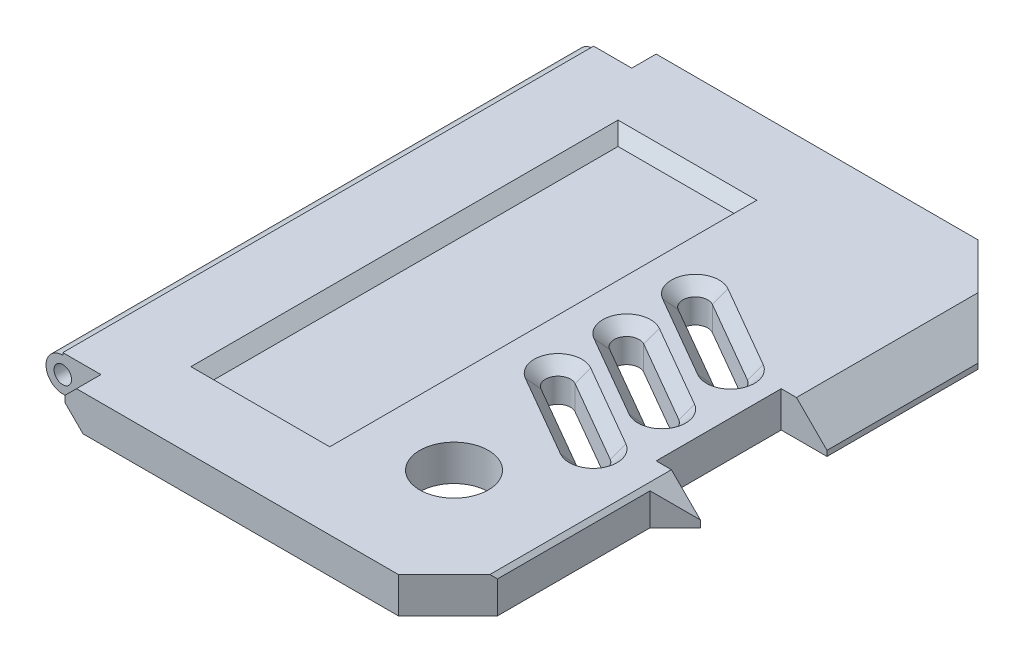
from build123d import *

# Parameters (mm, degrees)
BOSS_EXTRUDE1_START         = 10
SKETCH1_R                   = 1.15
BOSS_EXTRUDE1_DEPTH         = 76
SKETCH2_W                   = 6
SKETCH2_H                   = 16.4
CUT_EXTRUDE1_DEPTH          = 76
BOSS_EXTRUDE2_START         = -22
BOSS_EXTRUDE2_DEPTH         = 22
BOSS_EXTRUDE2_2_DEPTH       = 2
BOSS_EXTRUDE2_3_OUTLINE_W   = 6
BOSS_EXTRUDE2_3_OUTLINE_H   = 16
BOSS_EXTRUDE2_3_OUTLINE_W_2 = 5
BOSS_EXTRUDE2_3_OUTLINE_H_2 = 3
BOSS_EXTRUDE2_3_DEPTH       = 5
BOSS_EXTRUDE2_START_2       = -51.8
BOSS_EXTRUDE2_4_DEPTH       = 67
BOSS_EXTRUDE2_START_3       = -59
BOSS_EXTRUDE2_5_OUTLINE_R   = 1.15
BOSS_EXTRUDE2_5_DEPTH       = 78
CHAMFER1_SIZE               = 10
CHAMFER2_SIZE               = 4
CHAMFER3_SIZE               = 4
SKETCH4_W                   = 6
SKETCH4_H                   = 3.2
CUT_EXTRUDE2_DEPTH          = 17
CUT_EXTRUDE4_DEPTH          = 30
CUT_EXTRUDE4_DEPTH_BACK     = 41
SKETCH5_W                   = 96.095535807
SKETCH5_H                   = 97.903785136
SKETCH6_W                   = 65.908561939
SKETCH6_H                   = 2.295323053
CUT_EXTRUDE5_DEPTH          = 108
CUT_EXTRUDE6_DEPTH          = 108
SKETCH9_W                   = 18.2
SKETCH9_H                   = 56
CUT_EXTRUDE8_DEPTH          = 1.5
CUT_EXTRUDE9_DEPTH          = 13.5
CHAMFER4_SIZE               = 1.5
CHAMFER5_SIZE               = 1.5
CUT_EXTRUDE10_DEPTH         = 3.2
CUT_EXTRUDE11_DEPTH         = 3.2
CHAMFER6_SIZE               = 1.5
CUT_EXTRUDE12_DEPTH         = 26
SKETCH15_R                  = 4.5
CUT_EXTRUDE13_DEPTH         = 12


with BuildPart() as part:
    # Sketch1 → Boss-Extrude1 (new body)
    with BuildSketch(Plane(origin=(0, 0, -57.8), x_dir=(-1, 0, 0), z_dir=(0, 0, -1)).offset(BOSS_EXTRUDE1_START)):
        with BuildLine():
            Line((39, 25), (-18.2, 25))
            Line((-18.2, 25), (-18.2, 20))
            Line((-18.2, 20), (39, 20))
            ThreePointArc((39, 20), (41.5, 22.5), (39, 25))
        make_face()
        with Locations((39, 22.5)):
            Circle(SKETCH1_R, mode=Mode.SUBTRACT)
    extrude(amount=BOSS_EXTRUDE1_DEPTH)

    # Sketch2 → Cut-Extrude1 (cut)
    with BuildSketch(Plane(origin=(0, 25, 0), x_dir=(1, 0, 0), z_dir=(0, 1, 0))):
        with Locations((15.2, 105.8)):
            Rectangle(SKETCH2_W, SKETCH2_H)
    extrude(amount=-CUT_EXTRUDE1_DEPTH, mode=Mode.SUBTRACT)

    # Chamfer1
    chamfer1_edges = [part.edges().sort_by_distance(p)[0] for p in [
        (18.2, 22.5, -143.8),
        (18.2, 22.5, -67.8),
    ]]
    chamfer(chamfer1_edges, length=CHAMFER1_SIZE)

    # Chamfer2
    chamfer2_edges = [part.edges().sort_by_distance(p)[0] for p in [
        (18.2, 25, -87.7),
        (18.2, 25, -123.9),
    ]]
    chamfer(chamfer2_edges, length=CHAMFER2_SIZE)

    # Sketch4 → Cut-Extrude2 (cut)
    with BuildSketch(Plane(origin=(0, 25, 0), x_dir=(1, 0, 0), z_dir=(0, 1, 0))):
        with Locations((-38.5, 69.4)):
            Rectangle(SKETCH4_W, SKETCH4_H)
        with Locations((-38.5, 142.2)):
            Rectangle(SKETCH4_W, SKETCH4_H)
    extrude(amount=-CUT_EXTRUDE2_DEPTH, mode=Mode.SUBTRACT)

    # Sketch6 → Cut-Extrude5 (cut)
    with BuildSketch(Plane(origin=(0, 0, -143.8), x_dir=(-1, 0, 0), z_dir=(0, 0, -1))):
        with Locations((13.043955502, 19.152338474)):
            Rectangle(SKETCH6_W, SKETCH6_H)
    extrude(amount=-CUT_EXTRUDE5_DEPTH, mode=Mode.SUBTRACT)

    # Sketch7 → Cut-Extrude6 (cut)
    with BuildSketch(Plane(origin=(0, 0, -140.6), x_dir=(-1, 0, 0), z_dir=(0, 0, -1))):
        with BuildLine():
            Line((39, 24.7), (39, 27.795668708))
            Line((39, 27.795668708), (44.096773439, 22.698895269))
            Line((44.096773439, 22.698895269), (43.273657472, 20.3))
            Line((43.273657472, 20.3), (39, 20.3))
            ThreePointArc((39, 20.3), (41.2, 22.5), (39, 24.7))
        make_face()
    extrude(amount=-CUT_EXTRUDE6_DEPTH, mode=Mode.SUBTRACT)

    # Sketch9 → Cut-Extrude8 (cut)
    with BuildSketch(Plane(origin=(0, 25, 0), x_dir=(1, 0, 0), z_dir=(0, 1, 0))):
        with Locations((-19.9, 105.8)):
            Rectangle(SKETCH9_W, SKETCH9_H)
    extrude(amount=-CUT_EXTRUDE8_DEPTH, mode=Mode.SUBTRACT)

    # Sketch11 → Cut-Extrude9 (cut)
    with BuildSketch(Plane(origin=(0, 25, 0), x_dir=(1, 0, 0), z_dir=(0, 1, 0))):
        with BuildLine():
            Line((-3.382273892, 102.55565443), (7.524013646, 96.258906385))
            ThreePointArc((7.524013646, 96.258906385), (8.123454363, 94.021763172), (5.886311151, 93.422322455))
            Line((5.886311151, 93.422322455), (-5.019976387, 99.719070501))
            ThreePointArc((-5.019976387, 99.719070501), (-5.619417104, 101.956213713), (-3.382273892, 102.55565443))
        make_face()
        with BuildLine():
            Line((-3.382273892, 111.55565443), (7.524013646, 105.258906385))
            ThreePointArc((7.524013646, 105.258906385), (8.123454363, 103.021763172), (5.886311151, 102.422322455))
            Line((5.886311151, 102.422322455), (-5.019976387, 108.719070501))
            ThreePointArc((-5.019976387, 108.719070501), (-5.619417104, 110.956213713), (-3.382273892, 111.55565443))
        make_face()
        with BuildLine():
            Line((-3.382273892, 120.55565443), (7.524013646, 114.258906385))
            ThreePointArc((7.524013646, 114.258906385), (8.123454363, 112.021763172), (5.886311151, 111.422322455))
            Line((5.886311151, 111.422322455), (-5.019976387, 117.719070501))
            ThreePointArc((-5.019976387, 117.719070501), (-5.619417104, 119.956213713), (-3.382273892, 120.55565443))
        make_face()
    extrude(amount=-CUT_EXTRUDE9_DEPTH, mode=Mode.SUBTRACT)

    # Chamfer4
    chamfer4_edges = [part.edges().sort_by_distance(p)[0] for p in [
        (-19.9, 23.5, -133.8),
        (-10.8, 23.5, -105.8),
        (-19.9, 23.5, -77.8),
        (-29, 23.5, -105.8),
    ]]
    chamfer(chamfer4_edges, length=CHAMFER4_SIZE - 0.0001)  # a hair under: the kernel refuses the full size

    # Chamfer5
    chamfer5_edges = [part.edges().sort_by_distance(p)[0] for p in [
        (-5.619417104, 25, -110.956213713),
        (0.433167382, 25, -105.570696478),
        (8.123454363, 25, -103.021763172),
        (2.070869877, 25, -108.407280407),
        (-5.619417104, 25, -119.956213713),
        (0.433167382, 25, -114.570696478),
        (8.123454363, 25, -112.021763172),
        (2.070869877, 25, -117.407280407),
        (-5.619417104, 25, -101.956213713),
        (0.433167382, 25, -96.570696478),
        (8.123454363, 25, -94.021763172),
        (2.070869877, 25, -99.407280407),
    ]]
    chamfer(chamfer5_edges, length=CHAMFER5_SIZE)

    # Sketch12 → Cut-Extrude10 (cut)
    with BuildSketch(Plane(origin=(0, 0, -143.8), x_dir=(-1, 0, 0), z_dir=(0, 0, -1))):
        Polygon((35.5, 22.65), (33.15, 20.3), (34.627405096, 18.349875441), (37.777251213, 19.324937721), align=None)
    extrude(amount=-CUT_EXTRUDE10_DEPTH, mode=Mode.SUBTRACT)

    # Sketch13 → Cut-Extrude11 (cut)
    with BuildSketch(Plane.XY.offset(-67.8)):
        Polygon((-35.5, 22.65), (-33.15, 20.3), (-32.556705416, 17.347754732), (-36.536239956, 18.083750154), align=None)
    extrude(amount=-CUT_EXTRUDE11_DEPTH, mode=Mode.SUBTRACT)

    # Chamfer6
    chamfer6_edges = [part.edges().sort_by_distance(p)[0] for p in [
        (-35.5, 25, -69.4),
        (-35.5, 25, -142.2),
    ]]
    chamfer(chamfer6_edges, length=CHAMFER6_SIZE)

    # Sketch14 → Cut-Extrude12 (cut)
    with BuildSketch(Plane.XZ.offset(-20.3)):
        Polygon((18.2, -97.8), (14.7, -94.3), (14.7, -71.715249411), (21.506629366, -77.723703215), (19.139662716, -97.460563588), align=None)
    extrude(amount=-CUT_EXTRUDE12_DEPTH, mode=Mode.SUBTRACT)

    # Sketch15 → Cut-Extrude13 (cut)
    with BuildSketch(Plane.XZ.offset(-20.3)):
        with Locations(Location((0, -83.3, 0), (0, 0, 270))):
            Circle(SKETCH15_R)
    extrude(amount=-CUT_EXTRUDE13_DEPTH, mode=Mode.SUBTRACT)


with BuildPart() as body_2:
    # Boss-Extrude2: read off the stored shape, not the designer's step
    # Boss-Extrude2 outline → Boss-Extrude2 (new body)
    with BuildSketch(Plane(origin=(0, 20, 0), x_dir=(1, 0, 0), z_dir=(0, 1, 0)).offset(BOSS_EXTRUDE2_START)):
        Polygon((18.2, 47.8), (8.2, 57.8), (-41.5, 57.8), (-41.5, -18.2), (8.2, -18.2), (18.2, -8.2), align=None)
        with BuildLine():
            Line((-20, -15.2), (-38.5, -15.2))
            Line((-38.5, -15.2), (-38.5, 54.8))
            Line((-38.5, 54.8), (1.49684114, 54.8))
            Line((1.49684114, 54.8), (1.49684114, 39.499999909))
            Line((1.49684114, 39.499999909), (11.34684114, 39.499999909))
            Line((11.34684114, 39.499999909), (11.34684114, 10.113812147))
            ThreePointArc((11.34684114, 10.113812147), (0.0047491, -15.199999258), (-11.35315886, 10.10671974))
            Line((-11.35315886, 10.10671974), (-11.35315886, 39.499999909))
            Line((-11.35315886, 39.499999909), (-1.50315886, 39.499999909))
            Line((-1.50315886, 39.499999909), (-1.50315886, 51.8))
            Line((-1.50315886, 51.8), (-20, 51.8))
            Line((-20, 51.8), (-20, -15.2))
        make_face(mode=Mode.SUBTRACT)
    extrude(amount=BOSS_EXTRUDE2_DEPTH)

    # Boss-Extrude2 2 outline → Boss-Extrude2 2 (add)
    with BuildSketch(Plane(origin=(0, 20, 0), x_dir=(1, 0, 0), z_dir=(0, 1, 0)).offset(BOSS_EXTRUDE2_START)):
        with BuildLine():
            Line((1.49684114, 54.8), (-38.5, 54.8))
            Line((-38.5, 54.8), (-38.5, -15.2))
            Line((-38.5, -15.2), (-20, -15.2))
            Line((-20, -15.2), (-20, 51.8))
            Line((-20, 51.8), (-1.50315886, 51.8))
            Line((-1.50315886, 51.8), (-1.50315886, 39.499999909))
            Line((-1.50315886, 39.499999909), (-11.35315886, 39.499999909))
            Line((-11.35315886, 39.499999909), (-11.35315886, 10.10671974))
            ThreePointArc((-11.35315886, 10.10671974), (0.0047491, -15.199999258), (11.34684114, 10.113812147))
            Line((11.34684114, 10.113812147), (11.34684114, 39.499999909))
            Line((11.34684114, 39.499999909), (1.49684114, 39.499999909))
            Line((1.49684114, 39.499999909), (1.49684114, 54.8))
        make_face()
    extrude(amount=BOSS_EXTRUDE2_2_DEPTH)

    # Boss-Extrude2 3 outline → Boss-Extrude2 3 (add)
    with BuildSketch(Plane(origin=(0, 20, 0), x_dir=(1, 0, 0), z_dir=(0, 1, 0))):
        with Locations((15.2, 19.8)):
            Rectangle(BOSS_EXTRUDE2_3_OUTLINE_W, BOSS_EXTRUDE2_3_OUTLINE_H)
        with Locations((-39, 56.3)):
            Rectangle(BOSS_EXTRUDE2_3_OUTLINE_W_2, BOSS_EXTRUDE2_3_OUTLINE_H_2)
        with Locations((-39, -16.7)):
            Rectangle(BOSS_EXTRUDE2_3_OUTLINE_W_2, BOSS_EXTRUDE2_3_OUTLINE_H_2)
    extrude(amount=BOSS_EXTRUDE2_3_DEPTH)

    # Boss-Extrude2 4 outline → Boss-Extrude2 4 (cut)
    with BuildSketch(Plane.XY.offset(BOSS_EXTRUDE2_START_2)):
        Polygon((-20, 15.5), (-15.5, 20), (-20, 20), align=None)
    extrude(amount=BOSS_EXTRUDE2_4_DEPTH, mode=Mode.SUBTRACT)

    # Boss-Extrude2 5 outline → Boss-Extrude2 5 (cut)
    with BuildSketch(Plane.XY.offset(BOSS_EXTRUDE2_START_3)):
        with BuildLine():
            ThreePointArc((-41.5, 23), (-40.914213562, 24.414213562), (-39.5, 25))
            Line((-39.5, 25), (-41.5, 25))
            Line((-41.5, 25), (-41.5, 23))
        make_face()
        with BuildLine():
            ThreePointArc((-38.5, 25), (-37.085786438, 24.414213562), (-36.5, 23))
            Line((-36.5, 23), (-36.5, 25))
            Line((-36.5, 25), (-38.5, 25))
        make_face()
        with Locations((-39, 22.5)):
            Circle(BOSS_EXTRUDE2_5_OUTLINE_R)
    extrude(amount=BOSS_EXTRUDE2_5_DEPTH, mode=Mode.SUBTRACT)

    # Chamfer3
    chamfer3_edges = [body_2.edges().sort_by_distance(p)[0] for p in [
        (18.2, 25, -19.8),
    ]]
    chamfer(chamfer3_edges, length=CHAMFER3_SIZE)

    # Sketch5 → Cut-Extrude4 (cut, two sides: drawn at the far end of the back side and taken through both)
    with BuildSketch(Plane(origin=(0, 25, 0), x_dir=(1, 0, 0), z_dir=(0, 1, 0)).offset(-CUT_EXTRUDE4_DEPTH_BACK)):
        with Locations((-8.937626006, 13.848107432)):
            Rectangle(SKETCH5_W, SKETCH5_H)
    extrude(amount=CUT_EXTRUDE4_DEPTH + CUT_EXTRUDE4_DEPTH_BACK, mode=Mode.SUBTRACT)


solid = part.part
